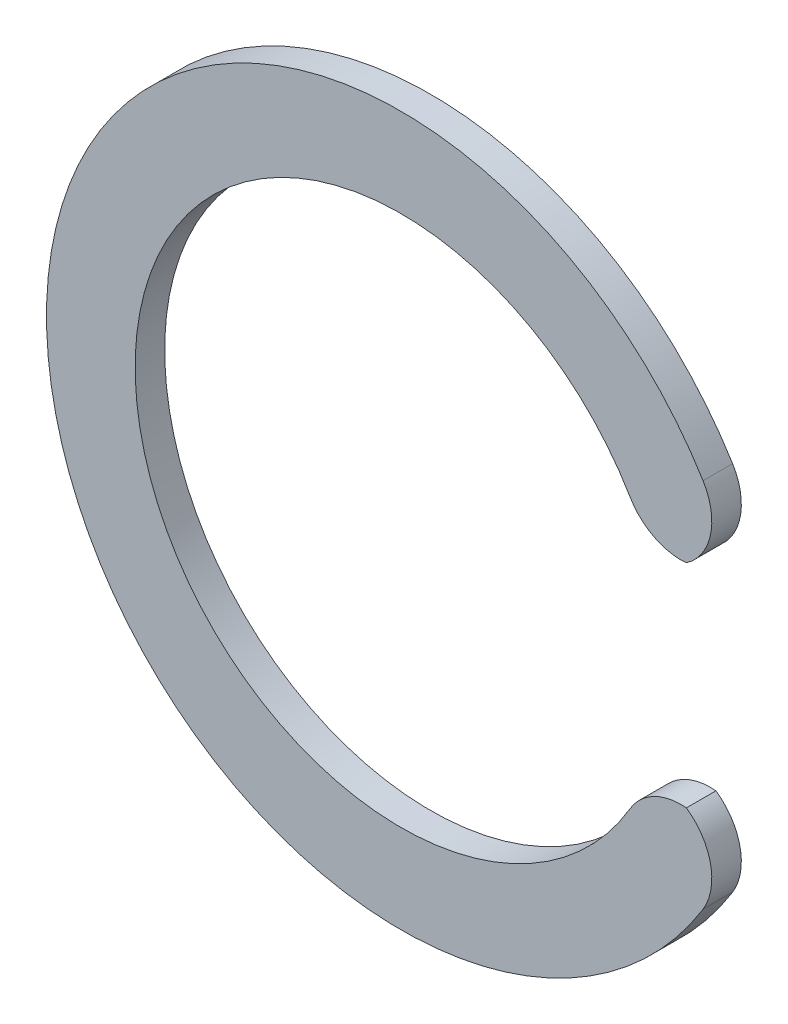
from build123d import *

# Parameters (mm, degrees)
SKETCH1_R           = 6
SKETCH1_R_2         = 4.5
BOSS_EXTRUDE1_DEPTH = 0.5
CUT_EXTRUDE1_START  = -0.5
CUT_EXTRUDE1_DEPTH  = 0.5
FILLET1_R           = 1


with BuildPart() as part:
    # Sketch1 → Boss-Extrude1 (new body)
    with BuildSketch(Plane.XY):
        Circle(SKETCH1_R)
        Circle(SKETCH1_R_2, mode=Mode.SUBTRACT)
    extrude(amount=BOSS_EXTRUDE1_DEPTH)

    # Sketch2 → Cut-Extrude1 (cut)
    with BuildSketch(Plane.XY.offset(0.5).offset(CUT_EXTRUDE1_START)):
        with BuildLine():
            Line((5.637224766, 2.054676846), (4.227918574, 1.541007634))
            ThreePointArc((4.227918574, 1.541007634), (4.431457637, 0.782421375), (4.5, 0))
            ThreePointArc((4.5, 0), (4.431457637, -0.782421375), (4.227918574, -1.541007634))
            Line((4.227918574, -1.541007634), (5.637224766, -2.054676846))
            ThreePointArc((5.637224766, -2.054676846), (5.908610183, -1.0432285), (6, 0))
            ThreePointArc((6, 0), (5.908610183, 1.0432285), (5.637224766, 2.054676846))
        make_face()
    extrude(amount=CUT_EXTRUDE1_DEPTH, mode=Mode.SUBTRACT)

    # Fillet1
    # the kernel refuses this fillet: 1 mm, written as the material it takes off along each edge
    with BuildSketch(Plane(origin=(4.227918574, -1.541007634, -2.270817283), x_dir=(0.9395374609645726, -0.3424461409393371, 0), z_dir=(0, 0, 1))) as fillet1_piece_1:
        with BuildLine():
            CenterArc((0.908326913, -1), FILLET1_R, 90, 79.524318304)
            ThreePointArc((-0.075005253, -0.818181818), (-0.018790545, -0.410806303), (0, 0))
            Line((0, 0), (0.908326913, 0))
        make_face()
    extrude(amount=5.041634566, mode=Mode.SUBTRACT)
    with BuildSketch(Plane(origin=(5.637224766, -2.054676846, -3.01526886), x_dir=(-0.4351439810441928, -0.9003608808477915, 0), z_dir=(0, 0, 1))) as fillet1_piece_2:
        with BuildLine():
            CenterArc((1.105598582, -0.994936153), FILLET1_R, 84.231520484, 101.536959033)
            Line((0.110662429, -1.095445115), (0, 0))
            ThreePointArc((0, 0), (0.603053772, 0.030383082), (1.206107544, 0))
        make_face()
    extrude(amount=6.53053772, mode=Mode.SUBTRACT)
    with BuildSketch(Plane(origin=(4.227918574, 1.541007634, -2.270817283), x_dir=(0.9395374609645728, 0.3424461409393367, 0), z_dir=(0, 0, 1))) as fillet1_piece_3:
        with BuildLine():
            CenterArc((0.908326913, 1), FILLET1_R, 190.475681696, 79.524318304)
            ThreePointArc((-0.075005253, 0.818181818), (-0.018790545, 0.410806303), (0, 0))
            Line((0, 0), (0.908326913, 0))
        make_face()
    extrude(amount=5.041634566, mode=Mode.SUBTRACT)
    with BuildSketch(Plane(origin=(5.637224766, 2.054676846, -3.01526886), x_dir=(-0.43514398104419194, 0.9003608808477921, 0), z_dir=(0, 0, 1))) as fillet1_piece_4:
        with BuildLine():
            CenterArc((1.105598582, 0.994936153), FILLET1_R, 174.231520484, 101.536959033)
            Line((0.110662429, 1.095445115), (0, 0))
            ThreePointArc((0, 0), (0.603053772, -0.030383082), (1.206107544, 0))
        make_face()
    extrude(amount=6.53053772, mode=Mode.SUBTRACT)


solid = part.part
